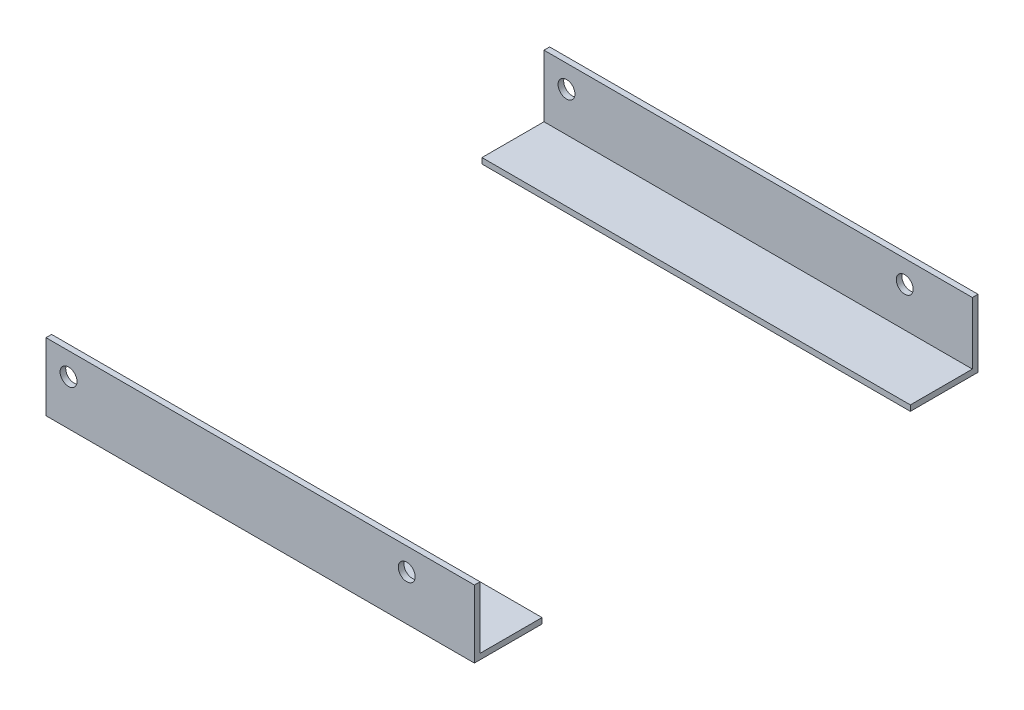
from build123d import *

# Parameters (mm, degrees)
EXTRUDE_THIN1_DEPTH     = 190.5
EXTRUDE_THIN2_DEPTH     = 241.3
CUT_EXTRUDE3_DEPTH      = 311.192787835
CUT_EXTRUDE3_DEPTH_BACK = 311.192787835
SKETCH5_R               = 4.7625
CUT_EXTRUDE4_DEPTH      = 311.192787835
CUT_EXTRUDE4_DEPTH_BACK = 311.192787835
SKETCH6_W               = 38.1
SKETCH6_H               = 41.275


with BuildPart() as part:
    # Sketch1 → Extrude-Thin1 (new, symmetric)
    with BuildSketch(Plane.XY):
        Polygon((38.1, 0), (0, 0), (0, 38.1), (3.175, 38.1), (3.175, 3.175), (38.1, 3.175), align=None)
    extrude(amount=EXTRUDE_THIN1_DEPTH, both=True)

    # Sketch2 → Extrude-Thin2 (add)
    with BuildSketch(Plane.ZY):
        Polygon((103.7336, 3.175), (141.8336, 3.175), (141.8336, 41.275), (138.6586, 41.275), (138.6586, 6.35), (103.7336, 6.35), align=None)
        Polygon((-103.7336, 3.175), (-141.8336, 3.175), (-141.8336, 41.275), (-138.6586, 41.275), (-138.6586, 6.35), (-103.7336, 6.35), align=None)
    extrude(amount=EXTRUDE_THIN2_DEPTH)

    # Sketch5 → Cut-Extrude3 (cut, two sides: drawn at the far end of the back side and taken through both)
    with BuildSketch(Plane.XY.offset(-CUT_EXTRUDE3_DEPTH_BACK)):
        with Locations((-228.6, 28.575)):
            Circle(SKETCH5_R)
        with Locations((-38.1, 28.575)):
            Circle(SKETCH5_R)
    extrude(amount=CUT_EXTRUDE3_DEPTH + CUT_EXTRUDE3_DEPTH_BACK, mode=Mode.SUBTRACT)

    # Sketch6 → Cut-Extrude4 (cut, two sides: drawn at the far end of the back side and taken through both)
    with BuildSketch(Plane.XY.offset(-CUT_EXTRUDE4_DEPTH_BACK)):
        with Locations((19.05, 20.6375)):
            Rectangle(SKETCH6_W, SKETCH6_H)
    extrude(amount=CUT_EXTRUDE4_DEPTH + CUT_EXTRUDE4_DEPTH_BACK, mode=Mode.SUBTRACT)


with BuildPart() as cut_extrude4_piece_1:
    # of the separate pieces the step leaves, piece 1, a body of its own (cut_extrude4_pieces)
    add(part.part.solids().sort_by_distance((0, 3.175, 141.8336))[0])


with BuildPart() as cut_extrude4_piece_2:
    # of the separate pieces the step leaves, piece 2, a body of its own (cut_extrude4_pieces)
    add(part.part.solids().sort_by_distance((0, 41.275, -138.6586))[0])


solid = Compound([cut_extrude4_piece_1.part, cut_extrude4_piece_2.part])
